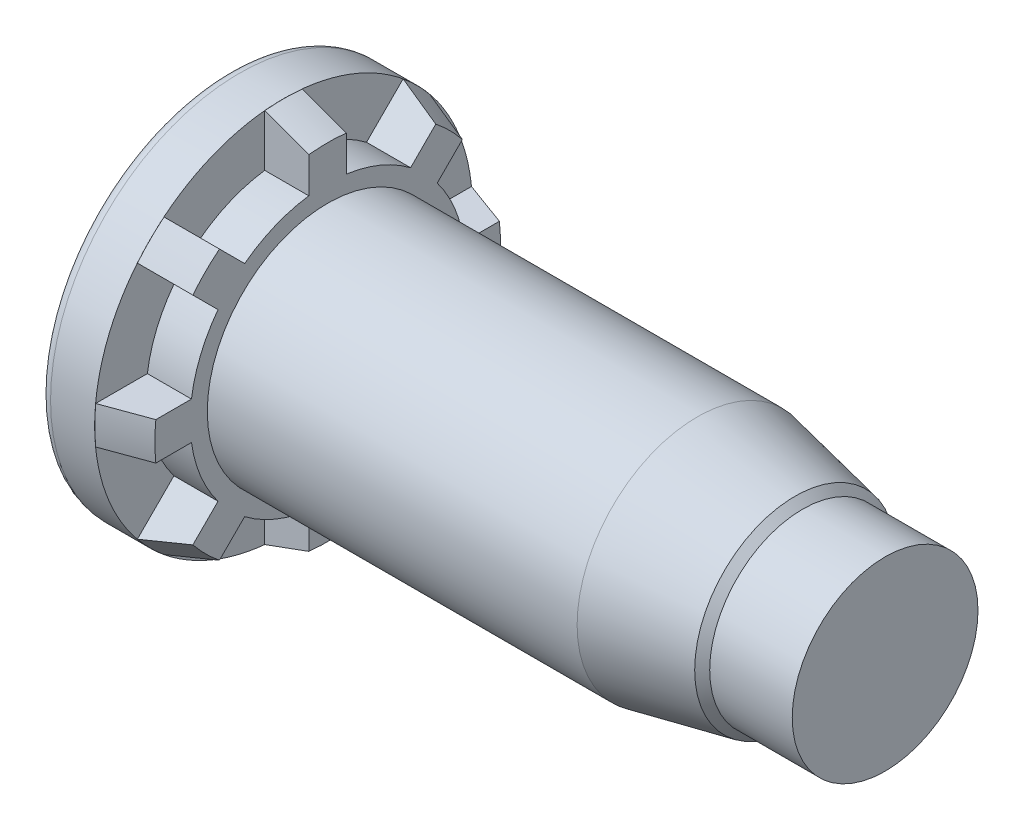
from build123d import *

# Parameters (mm, degrees)
RIBCUT_START     = -1.832
RIBCUT_DEPTH     = 1.832
RIBCUTSPAT_COUNT = 8
RIBCUTSPAT_ANGLE = 315


with BuildPart() as part:
    # BodySke → BaseBody (revolve)
    with BuildSketch(Plane.XY):
        with BuildLine():
            Line((-2.29, 7.392), (-2.29, 0))
            Line((-2.29, 0), (25, 0))
            Line((25, 0), (25, 3.86))
            Line((25, 3.86), (21.57, 3.86))
            Line((21.57, 3.86), (21.258, 4.172))
            Line((21.258, 4.172), (17.2, 5))
            Line((17.2, 5), (1.832, 5))
            Line((1.832, 5), (1.832, 7.181591015))
            Line((1.832, 7.181591015), (0.00254, 7.84746))
            Line((0.00254, 7.84746), (0, 7.84746))
            Line((0, 7.84746), (0, 7.85))
            Line((0, 7.85), (-1.832, 7.85))
            ThreePointArc((-1.832, 7.85), (-2.155854906, 7.715854906), (-2.29, 7.392))
        make_face()
    revolve(axis=Axis((0, 0, 0), (1, 0, 0)))

    # RibCutSke → RibCut (cut)
    with BuildSketch(Plane(origin=(1.832, 1.794401132, -0.090952894), x_dir=(0, 0, -1), z_dir=(1, 0, 0)).offset(RIBCUT_START)):
        with BuildLine():
            Line((0.691219431, 3.864296837), (0.691219431, 6.016533924))
            ThreePointArc((0.691219431, 6.016533924), (2.91311205, 5.458053198), (4.879132896, 4.281843369))
            Line((4.879132896, 4.281843369), (3.357271457, 2.759981929))
            ThreePointArc((3.357271457, 2.759981929), (2.095126213, 3.483260697), (0.691219431, 3.864296837))
        make_face()
    ribcut = extrude(amount=RIBCUT_DEPTH, mode=Mode.SUBTRACT)

    # RibCutsPat: RibCut ×8 about axis
    ribcutspat_axis = Axis((0, 0, 0), (1, 0, 0))
    for i in range(1, RIBCUTSPAT_COUNT):
        add(ribcut.rotate(ribcutspat_axis, i * RIBCUTSPAT_ANGLE / (RIBCUTSPAT_COUNT - 1)), mode=Mode.SUBTRACT)


solid = part.part
